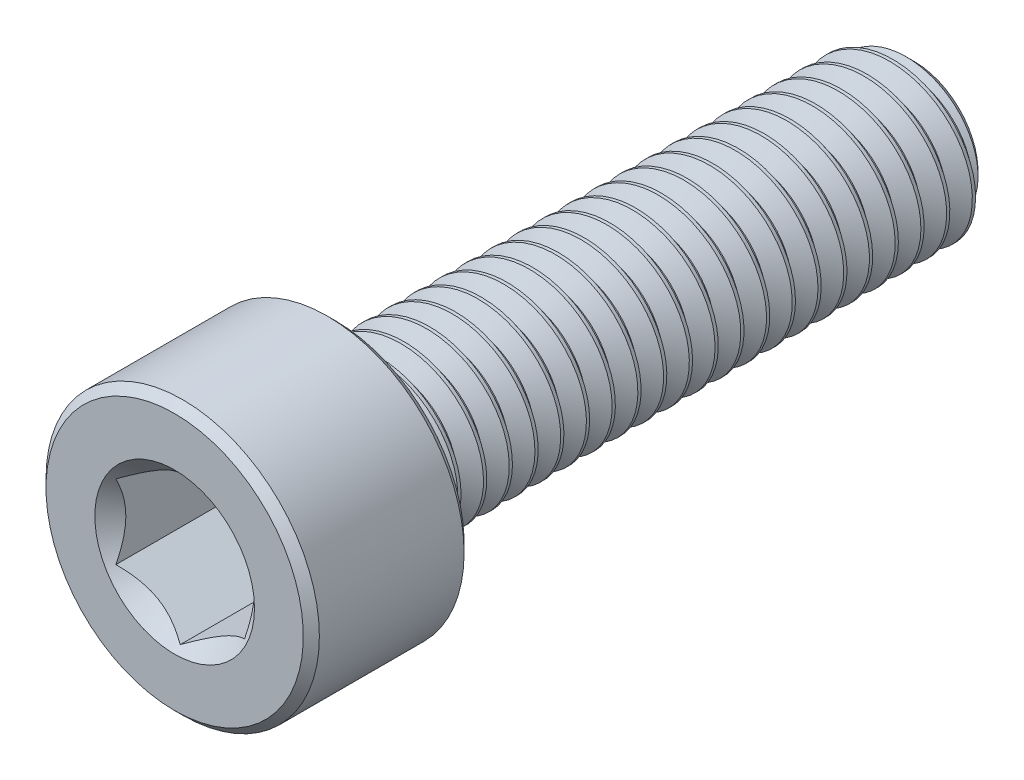
from build123d import *

# Parameters (mm, degrees)
CUT_EXTRUDE1_DEPTH     = 4
SPLIT1_SURFACE_1_BACK  = 26.952
SPLIT1_SURFACE_1_DEPTH = 53.904
SPLIT1_SURFACE_2_BACK  = 26.952
SPLIT1_SURFACE_2_DEPTH = 53.904
CUT_SWEEP1_PITCH       = 0.8


with BuildPart() as part:
    # Sketch2 → Revolve1 (revolve)
    with BuildSketch(Plane(origin=(0, 0, 0), x_dir=(0, 0, -1), z_dir=(1, 0, 0))):
        with BuildLine():
            Line((-11.5, 0), (-11.5, 4))
            Line((-11.5, 4), (-11.25, 4.25))
            Line((-11.25, 4.25), (-6.75, 4.25))
            Line((-6.75, 4.25), (-6.5, 4))
            Line((-6.5, 4), (-6.5, 2.75))
            ThreePointArc((-6.5, 2.75), (-6.426776695, 2.573223305), (-6.25, 2.5))
            Line((-6.25, 2.5), (10.980384758, 2.5))
            Line((10.980384758, 2.5), (11.5, 1.980384758))
            Line((11.5, 1.980384758), (11.5, 0))
            Line((11.5, 0), (-11.5, 0))
        make_face()
    revolve(axis=Axis((0, 0, -11.5), (0, 0, 1)))

    # Sketch3 → Cut-Extrude1 (cut)
    with BuildSketch(Plane.XY.offset(11.5)):
        Polygon((2, -1.154700538), (2, 1.154700538), (0, 2.309401077), (-2, 1.154700538), (-2, -1.154700538), (0, -2.309401077), align=None)
    extrude(amount=-CUT_EXTRUDE1_DEPTH, mode=Mode.SUBTRACT)

    # Cut-Extrude2 cone 1 section (through the dimple's axis) → Cut-Extrude2 (revolve, cut)
    with BuildSketch(Plane(origin=(0, 0, 11.5), x_dir=(0, -1, 0), z_dir=(1, 0, 0))):
        Polygon((0, 0), (2.482606158, 0), (0, 2.482606158), align=None)
    revolve(axis=Axis((0, 0, 11.5), (0, 0, -1)), mode=Mode.SUBTRACT)


with BuildPart() as body_2:
    # Split1: the piece behind the surface
    add(part.part)
    # Split1 surface: a surface, the sketch's curves swept straight by 53.904 mm
    with BuildLine(Plane(origin=(0, 0, 0), x_dir=(0, 0, -1), z_dir=(1, 0, 0)).offset(-SPLIT1_SURFACE_1_BACK), mode=Mode.PRIVATE) as split1_surface_1_path:
        Line((-6.25, -4.25), (-6.25, 4.25))
    split1_surface_1 = Shell.extrude(split1_surface_1_path.wire(), (1 * SPLIT1_SURFACE_1_DEPTH, 0 * SPLIT1_SURFACE_1_DEPTH, 0 * SPLIT1_SURFACE_1_DEPTH))
    split(bisect_by=split1_surface_1, keep=Keep.BOTTOM)

    # Cut-Sweep1: the profile of Sketch7 screwed along a right-hand helix of 23.5 turns, 8 arcs to a turn; built about Z, then put on its axis
    cut_sweep1_z = Axis((0, 0, 0), (0, 0, 1))
    cut_sweep1_corners = [(2.54330127, 0, 0.025), (2.54330127, 0, -0.725), (1.980384758, 0, -0.4), (1.980384758, 0, -0.3)]
    with BuildLine(mode=Mode.PRIVATE) as cut_sweep1_profile:
        Line(cut_sweep1_corners[0], cut_sweep1_corners[1])
        Line(cut_sweep1_corners[1], cut_sweep1_corners[2])
        Line(cut_sweep1_corners[2], cut_sweep1_corners[3])
        Line(cut_sweep1_corners[3], cut_sweep1_corners[0])
    cut_sweep1_cap = Face(cut_sweep1_profile.wire())
    cut_sweep1_turn_angles = [0, 22.5, 45, 67.5, 90, 112.5, 135, 157.5, 180, 202.5, 225, 247.5, 270, 292.5, 315, 337.5, 360]
    cut_sweep1_turn_weights = [1, 0.9238795325112867, 1, 0.9238795325112867, 1, 0.9238795325112867, 1, 0.9238795325112867, 1, 0.9238795325112867, 1, 0.9238795325112867, 1, 0.9238795325112867, 1, 0.9238795325112867, 1]
    cut_sweep1_turn_rails = [Edge.make_bspline([Vector(p[0], p[1], 0).rotate(cut_sweep1_z, cut_sweep1_turn_angles[k]) / cut_sweep1_turn_weights[k] + Vector(0, 0, p[2] + CUT_SWEEP1_PITCH * cut_sweep1_turn_angles[k] / 360) for k in range(17)], [0, 0, 0, 1, 1, 2, 2, 3, 3, 4, 4, 5, 5, 6, 6, 7, 7, 8, 8, 8], 2, cut_sweep1_turn_weights) for p in cut_sweep1_corners]
    cut_sweep1_turn_sides = [Face.make_surface_from_curves(cut_sweep1_turn_rails[p[0]], cut_sweep1_turn_rails[p[1]]) for p in [(0, 1), (1, 2), (2, 3), (3, 0)]]
    cut_sweep1_last_angles = [8280, 8302.5, 8325, 8347.5, 8370, 8392.5, 8415, 8437.5, 8460]
    cut_sweep1_last_weights = [1, 0.9238795325112867, 1, 0.9238795325112867, 1, 0.9238795325112867, 1, 0.9238795325112806, 1]
    cut_sweep1_last_rails = [Edge.make_bspline([Vector(p[0], p[1], 0).rotate(cut_sweep1_z, cut_sweep1_last_angles[k]) / cut_sweep1_last_weights[k] + Vector(0, 0, p[2] + CUT_SWEEP1_PITCH * cut_sweep1_last_angles[k] / 360) for k in range(9)], [0, 0, 0, 1, 1, 2, 2, 3, 3, 4, 4, 4], 2, cut_sweep1_last_weights) for p in cut_sweep1_corners]
    cut_sweep1_last_sides = [Face.make_surface_from_curves(cut_sweep1_last_rails[p[0]], cut_sweep1_last_rails[p[1]]) for p in [(0, 1), (1, 2), (2, 3), (3, 0)]]
    cut_sweep1 = Plane(origin=(0, 0, -11.5), x_dir=(0, 1, 0), z_dir=(0, 0, 1)) * Solid(Shell([*[p.moved(Location((0, 0, CUT_SWEEP1_PITCH * i))) for i in range(23) for p in cut_sweep1_turn_sides], *cut_sweep1_last_sides, cut_sweep1_cap, cut_sweep1_cap.rotate(cut_sweep1_z, 8460).moved(Location((0, 0, CUT_SWEEP1_PITCH * 8460 / 360)))]))
    add(cut_sweep1, mode=Mode.SUBTRACT)


with BuildPart() as part_1:
    add(part.part)

    # Split1: split by a surface, the side it looks to stays
    # Split1 surface: a surface, the sketch's curves swept straight by 53.904 mm
    with BuildLine(Plane(origin=(0, 0, 0), x_dir=(0, 0, -1), z_dir=(1, 0, 0)).offset(-SPLIT1_SURFACE_2_BACK), mode=Mode.PRIVATE) as split1_surface_2_path:
        Line((-6.25, -4.25), (-6.25, 4.25))
    split1_surface_2 = Shell.extrude(split1_surface_2_path.wire(), (1 * SPLIT1_SURFACE_2_DEPTH, 0 * SPLIT1_SURFACE_2_DEPTH, 0 * SPLIT1_SURFACE_2_DEPTH))
    split(bisect_by=split1_surface_2, keep=Keep.TOP)

    add(body_2.part)  # Revolve2 merges body 2
    # Sketch8 → Revolve2 (revolve)
    with BuildSketch(Plane(origin=(0, 0, 0), x_dir=(0, 0, -1), z_dir=(1, 0, 0)), mode=Mode.PRIVATE) as revolve2_sk:
        Polygon((-6.5, 0), (-6.5, 2.5), (-6.25, 2.5), (-4.806624327, 0), align=None)
    revolve(revolve2_sk.sketch.rotate(Axis((0, 0, 4.806624327), (0, 0, 1)), 270), axis=Axis((0, 0, 4.806624327), (0, 0, 1)))


solid = part_1.part
